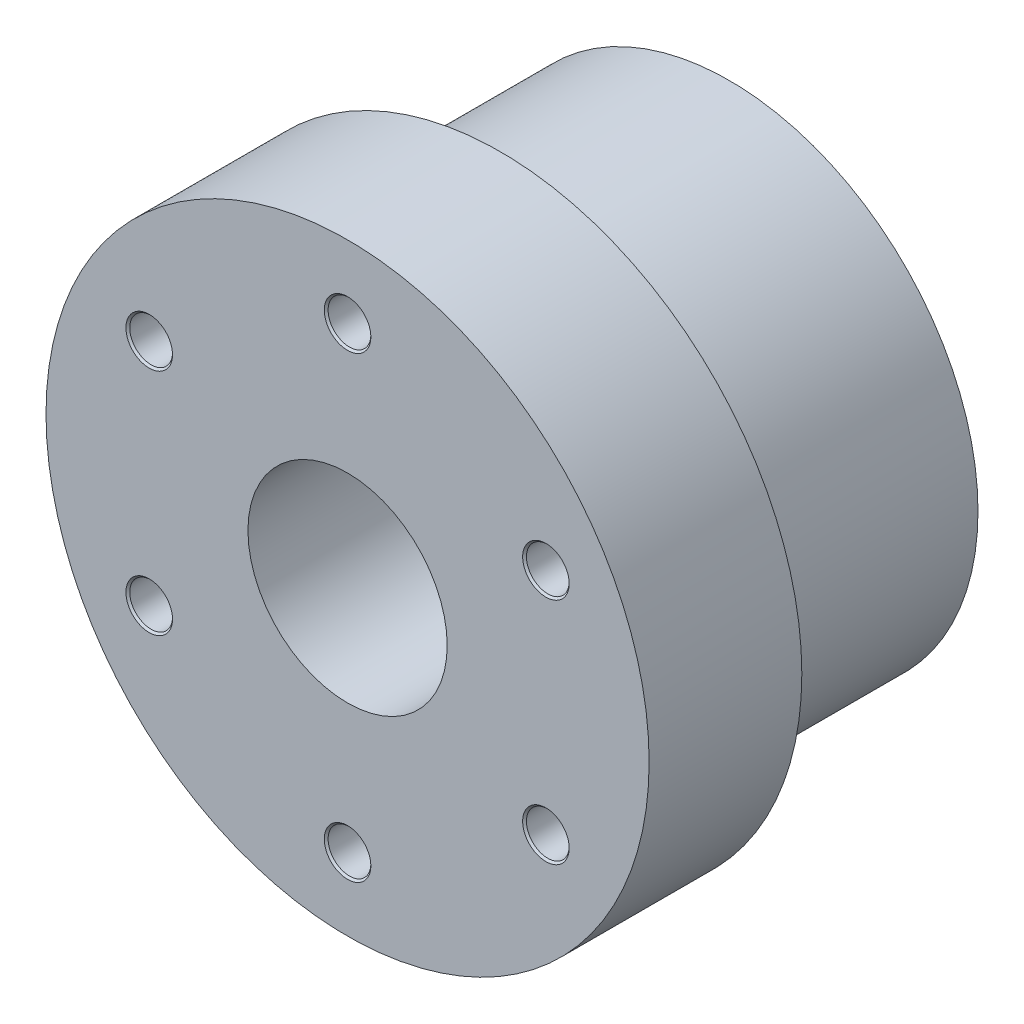
from build123d import *

# Parameters (mm, degrees)
SKETCH1_R           = 39.5
SKETCH1_R_2         = 13.05
BOSS_EXTRUDE1_DEPTH = 20
SKETCH2_R           = 32.575
BOSS_EXTRUDE3_DEPTH = 30
SKETCH1_5_R         = 2.8
CUT_EXTRUDE1_DEPTH  = 15
SKETCH3_R           = 2.6
CUT_EXTRUDE2_DEPTH  = 15
CHAMFER2_SIZE       = 0.25


with BuildPart() as part:
    # Sketch1 → Boss-Extrude1 (new body)
    with BuildSketch(Plane.XY):
        Circle(SKETCH1_R)
        Circle(SKETCH1_R_2, mode=Mode.SUBTRACT)
    extrude(amount=-BOSS_EXTRUDE1_DEPTH)

    # Sketch1<5> → Cut-Extrude1 (cut)
    with BuildSketch(Plane.XY):
        with Locations((0, 30)):
            Circle(SKETCH1_5_R)
        with Locations((25.980762114, 15)):
            Circle(SKETCH1_5_R)
        with Locations((25.980762114, -15)):
            Circle(SKETCH1_5_R)
        with Locations((0, -30)):
            Circle(SKETCH1_5_R)
        with Locations((-25.980762114, -15)):
            Circle(SKETCH1_5_R)
        with Locations((-25.980762114, 15)):
            Circle(SKETCH1_5_R)
    extrude(amount=-CUT_EXTRUDE1_DEPTH, mode=Mode.SUBTRACT)

    # Chamfer2
    chamfer2_edges = [part.edges().sort_by_distance(p)[0] for p in [
        (-2.8, 30, 0),
        (23.180762114, 15, 0),
        (23.180762114, -15, 0),
        (-2.8, -30, 0),
        (-28.780762114, -15, 0),
        (-28.780762114, 15, 0),
        (-2.8, 30, -15),
        (23.180762114, 15, -15),
        (23.180762114, -15, -15),
        (-2.8, -30, -15),
        (-28.780762114, -15, -15),
        (-28.780762114, 15, -15),
    ]]
    chamfer(chamfer2_edges, length=CHAMFER2_SIZE)


with BuildPart() as body_2:
    # Sketch2 → Boss-Extrude3 (new body)
    with BuildSketch(Plane(origin=(0, 0, -20), x_dir=(-1, 0, 0), z_dir=(0, 0, -1))):
        Circle(SKETCH2_R)
    extrude(amount=BOSS_EXTRUDE3_DEPTH)

    # Sketch3 → Cut-Extrude2 (cut)
    with BuildSketch(Plane(origin=(0, 0, -50), x_dir=(-1, 0, 0), z_dir=(0, 0, -1))):
        with Locations((0, 25)):
            Circle(SKETCH3_R)
        with Locations((21.650635095, 12.5)):
            Circle(SKETCH3_R)
        with Locations((21.650635095, -12.5)):
            Circle(SKETCH3_R)
        with Locations((0, -25)):
            Circle(SKETCH3_R)
        with Locations((-21.650635095, -12.5)):
            Circle(SKETCH3_R)
        with Locations((-21.650635095, 12.5)):
            Circle(SKETCH3_R)
    extrude(amount=-CUT_EXTRUDE2_DEPTH, mode=Mode.SUBTRACT)


solid = Compound([part.part, body_2.part])
